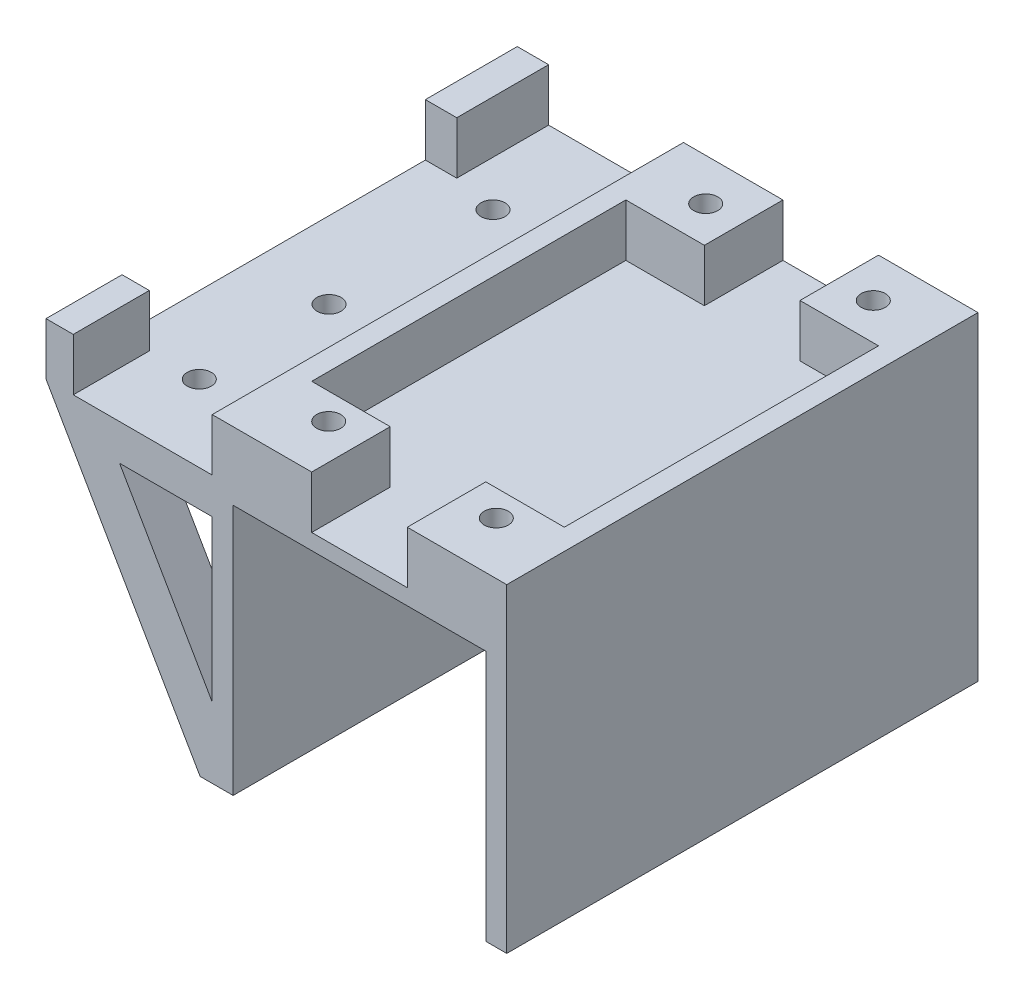
from build123d import *

# Parameters (mm, degrees)
SKETCH1_W            = 48.254
SKETCH1_H            = 10
BOSS_EXTRUDE1_DEPTH  = 70
BOSS_EXTRUDE3_DEPTH  = 8
BOSS_EXTRUDE4_DEPTH  = 8
BOSS_EXTRUDE5_DEPTH  = 8
BOSS_EXTRUDE6_DEPTH  = 70
SKETCH7_W            = 40.394634483
SKETCH7_H            = 17
CUT_EXTRUDE3_DEPTH   = 70
BOSS_EXTRUDE7_DEPTH  = 70
BOSS_EXTRUDE10_DEPTH = 8
BOSS_EXTRUDE11_DEPTH = 70
SKETCH13_W           = 83.001411072
SKETCH13_H           = 87.868559997
CUT_EXTRUDE4_DEPTH   = 4
SKETCH14_W           = 48.254
SKETCH14_H           = 10
BOSS_EXTRUDE12_DEPTH = 20
SKETCH16_W           = 56.254
SKETCH16_H           = 5
CUT_EXTRUDE5_DEPTH   = 100
SKETCH17_W           = 15
SKETCH17_H           = 15
BOSS_EXTRUDE14_DEPTH = 13
CUT_EXTRUDE8_DEPTH   = 5
SKETCH21_R           = 2.3
CUT_EXTRUDE9_DEPTH   = 15
SKETCH23_W           = 12
SKETCH23_H           = 40.530858039
CUT_EXTRUDE10_DEPTH  = 9
SKETCH25_R           = 2.3
CUT_EXTRUDE11_DEPTH  = 20
SKETCH26_R           = 2.3
CUT_EXTRUDE12_DEPTH  = 20
BOSS_EXTRUDE16_DEPTH = 20
SKETCH28_W           = 15
SKETCH28_H           = 15
BOSS_EXTRUDE17_DEPTH = 10
SKETCH29_R           = 2.3
CUT_EXTRUDE13_DEPTH  = 20
SKETCH30_W           = 10.391026801
SKETCH30_H           = 12
BOSS_EXTRUDE18_DEPTH = 5
SKETCH31_R           = 2.3
CUT_EXTRUDE14_DEPTH  = 45
SKETCH34_W           = 5.207466525
SKETCH34_H           = 14.522624233
SKETCH34_W_2         = 5.993175229
SKETCH34_H_2         = 17.54843303
BOSS_EXTRUDE19_DEPTH = 10


with BuildPart() as part:
    # Sketch1 → Boss-Extrude1 (new body)
    with BuildSketch(Plane.XY):
        Polygon((0, 70), (0, 0), (4, 0), (4, 52), (52.254, 52), (52.254, 0), (56.254, 0), (56.254, 70), align=None)
        with Locations((28.127, 60)):
            Rectangle(SKETCH1_W, SKETCH1_H, mode=Mode.SUBTRACT)
    extrude(amount=BOSS_EXTRUDE1_DEPTH)

    # Sketch3 → Boss-Extrude3 (add)
    with BuildSketch(Plane.XY.offset(70)):
        Polygon((0, 62.5), (0, 70), (-40.394634483, 70), (0, 0.034440722), (0, 17.466679003), (-26, 62.5), align=None)
    extrude(amount=-BOSS_EXTRUDE3_DEPTH)

    # Sketch4 → Boss-Extrude4 (add)
    with BuildSketch(Plane(origin=(0, 0, 0), x_dir=(-1, 0, 0), z_dir=(0, 0, -1))):
        Polygon((0, 70), (40.394634483, 70), (0, 0), (0, 17.466679003), (26, 62.5), (0, 62.5), align=None)
    extrude(amount=-BOSS_EXTRUDE4_DEPTH)

    # Sketch5 → Boss-Extrude5 (add)
    with BuildSketch(Plane(origin=(0, 0, 39), x_dir=(-1, 0, 0), z_dir=(0, 0, -1))):
        Polygon((0, 62.5), (0, 70), (40.394634483, 70), (0, 0), (0, 17.466679003), (26, 62.5), align=None)
    extrude(amount=BOSS_EXTRUDE5_DEPTH)

    # Sketch6 → Boss-Extrude6 (add)
    with BuildSketch(Plane(origin=(0, 0, 0), x_dir=(-1, 0, 0), z_dir=(0, 0, -1))):
        Polygon((0, 62.5), (36.066637932, 62.5), (40.394634483, 70), (0, 70), align=None)
        Polygon((-4, 0), (0, 0), (7.50186069, 13), (-4, 13), align=None)
    extrude(amount=-BOSS_EXTRUDE6_DEPTH)

    # Sketch7 → Cut-Extrude3 (cut)
    with BuildSketch(Plane.XY.offset(70)):
        with Locations((-20.197317242, 61.5)):
            Rectangle(SKETCH7_W, SKETCH7_H)
    extrude(amount=-CUT_EXTRUDE3_DEPTH, mode=Mode.SUBTRACT)

    # Sketch8 → Boss-Extrude7 (add)
    with BuildSketch(Plane(origin=(0, 0, 0), x_dir=(-1, 0, 0), z_dir=(0, 0, -1))):
        Polygon((-4, 55), (-4, 52), (30.007442759, 52), (31.73864138, 55), align=None)
    extrude(amount=-BOSS_EXTRUDE7_DEPTH)

    # Sketch11 → Boss-Extrude10 (add)
    with BuildSketch(Plane.XY.offset(70)):
        Polygon((-31.73864138, 55), (0, 0), (-3.053687451, 13), (-27.288965695, 55), align=None)
    extrude(amount=-BOSS_EXTRUDE10_DEPTH)

    # Sketch12 → Boss-Extrude11 (add)
    with BuildSketch(Plane.XY.offset(70)):
        Polygon((-31.73864138, 55), (-27.75981023, 48.105069917), (0, 48.105069917), (0, 55), align=None)
    extrude(amount=-BOSS_EXTRUDE11_DEPTH)

    # Sketch13 → Cut-Extrude4 (cut)
    with BuildSketch(Plane.XZ):
        with Locations((25.938658228, 33.313825886)):
            Rectangle(SKETCH13_W, SKETCH13_H)
    extrude(amount=-CUT_EXTRUDE4_DEPTH, mode=Mode.SUBTRACT)

    # Sketch14 → Boss-Extrude12 (add)
    with BuildSketch(Plane.XY.offset(70)):
        Polygon((-2.308264828, 4), (-31.73864138, 55), (0, 55), (0, 70), (56.254, 70), (56.254, 4), (52.254, 4), (52.254, 52), (4, 52), (4, 4), align=None)
        Polygon((-17.689083241, 48.105069917), (0, 48.105069917), (0, 17.466679003), align=None, mode=Mode.SUBTRACT)
        with Locations((28.127, 60)):
            Rectangle(SKETCH14_W, SKETCH14_H, mode=Mode.SUBTRACT)
    extrude(amount=BOSS_EXTRUDE12_DEPTH)

    # Sketch16 → Cut-Extrude5 (cut)
    with BuildSketch(Plane.XY.offset(90)):
        with Locations((28.127, 67.5)):
            Rectangle(SKETCH16_W, SKETCH16_H)
    extrude(amount=-CUT_EXTRUDE5_DEPTH, mode=Mode.SUBTRACT)

    # Sketch17 → Boss-Extrude14 (add)
    with BuildSketch(Plane(origin=(0, 65, 0), x_dir=(1, 0, 0), z_dir=(0, 1, 0))):
        with Locations((44.754, -7.5)):
            Rectangle(SKETCH17_W, SKETCH17_H)
        with Locations((44.754, -82.5)):
            Rectangle(SKETCH17_W, SKETCH17_H)
    extrude(amount=-BOSS_EXTRUDE14_DEPTH)

    # Sketch22 → Cut-Extrude8 (cut)
    with BuildSketch(Plane.XZ.offset(-52)):
        Polygon((48.096455918, 6.003620146), (47.904143628, 10.329474511), (44.06168771, 12.325854365), (40.411544082, 9.996379854), (40.603856372, 5.670525489), (44.44631229, 3.674145635), align=None)
        Polygon((45.200685086, 75.774625774), (48.386623963, 78.707166221), (47.439938877, 82.932540447), (43.307314914, 84.225374226), (40.121376037, 81.292833779), (41.068061123, 77.067459553), align=None)
    extrude(amount=-CUT_EXTRUDE8_DEPTH, mode=Mode.SUBTRACT)

    # Sketch21 → Cut-Extrude9 (cut)
    with BuildSketch(Plane(origin=(0, 52, 0), x_dir=(-1, 0, 0), z_dir=(0, -1, 0))):
        with Locations((-44.254, -80)):
            Circle(SKETCH21_R)
        with Locations((-44.254, -8)):
            Circle(SKETCH21_R)
    extrude(amount=-CUT_EXTRUDE9_DEPTH, mode=Mode.SUBTRACT)

    # Sketch23 → Cut-Extrude10 (cut)
    with BuildSketch(Plane(origin=(0, 0, 0), x_dir=(0, 0, 1), z_dir=(-0.8661319205837115, -0.49981546209173167, 0))):
        with Locations((76, 35.274689955)):
            Rectangle(SKETCH23_W, SKETCH23_H)
    extrude(amount=-CUT_EXTRUDE10_DEPTH, mode=Mode.SUBTRACT)

    # Sketch25 → Cut-Extrude11 (cut)
    with BuildSketch(Plane(origin=(0, 48.105069917, 0), x_dir=(-1, 0, 0), z_dir=(0, -1, 0))):
        with Locations((17.075514089, -19.30064897)):
            Circle(SKETCH25_R)
        with Locations((17.075514089, -50.613733273)):
            Circle(SKETCH25_R)
    extrude(amount=-CUT_EXTRUDE11_DEPTH, mode=Mode.SUBTRACT)

    # Sketch26 → Cut-Extrude12 (cut)
    with BuildSketch(Plane.XZ.offset(-48.105069917)):
        with Locations((-17.075514089, 75.391336138)):
            Circle(SKETCH26_R)
    extrude(amount=-CUT_EXTRUDE12_DEPTH, mode=Mode.SUBTRACT)

    # Sketch27 → Boss-Extrude16 (add)
    with BuildSketch(Plane.XY.offset(90)):
        Polygon((-23.310381194, 48.105069917), (-27.75981023, 48.105069917), (-31.73864138, 55), (-23.310381194, 55), align=None)
    extrude(amount=-BOSS_EXTRUDE16_DEPTH)

    # Sketch28 → Boss-Extrude17 (add)
    with BuildSketch(Plane(origin=(0, 55, 0), x_dir=(1, 0, 0), z_dir=(0, 1, 0))):
        with Locations((11.5, -7.5)):
            Rectangle(SKETCH28_W, SKETCH28_H)
        with Locations((11.5, -82.5)):
            Rectangle(SKETCH28_W, SKETCH28_H)
    extrude(amount=BOSS_EXTRUDE17_DEPTH)

    # Sketch29 → Cut-Extrude13 (cut)
    with BuildSketch(Plane(origin=(0, 52, 0), x_dir=(-1, 0, 0), z_dir=(0, -1, 0))):
        with Locations((-12.254, -8)):
            Circle(SKETCH29_R)
        with Locations((-12.254, -80)):
            Circle(SKETCH29_R)
    extrude(amount=-CUT_EXTRUDE13_DEPTH, mode=Mode.SUBTRACT)

    # Sketch30 → Boss-Extrude18 (add)
    with BuildSketch(Plane.XZ.offset(-48.105069917)):
        with Locations((-22.56429683, 76)):
            Rectangle(SKETCH30_W, SKETCH30_H)
    extrude(amount=-BOSS_EXTRUDE18_DEPTH)

    # Sketch31 → Cut-Extrude14 (cut)
    with BuildSketch(Plane.XZ.offset(-48.105069917)):
        with Locations((-17.075514089, 75.391336138)):
            Circle(SKETCH31_R)
    extrude(amount=-CUT_EXTRUDE14_DEPTH, mode=Mode.SUBTRACT)

    # Sketch34 → Boss-Extrude19 (add)
    with BuildSketch(Plane(origin=(0, 55, 0), x_dir=(1, 0, 0), z_dir=(0, 1, 0))):
        with Locations((-29.134908118, -82.738687884)):
            Rectangle(SKETCH34_W, SKETCH34_H)
        with Locations((-28.742053766, -8.774216515)):
            Rectangle(SKETCH34_W_2, SKETCH34_H_2)
    extrude(amount=BOSS_EXTRUDE19_DEPTH)


solid = part.part
